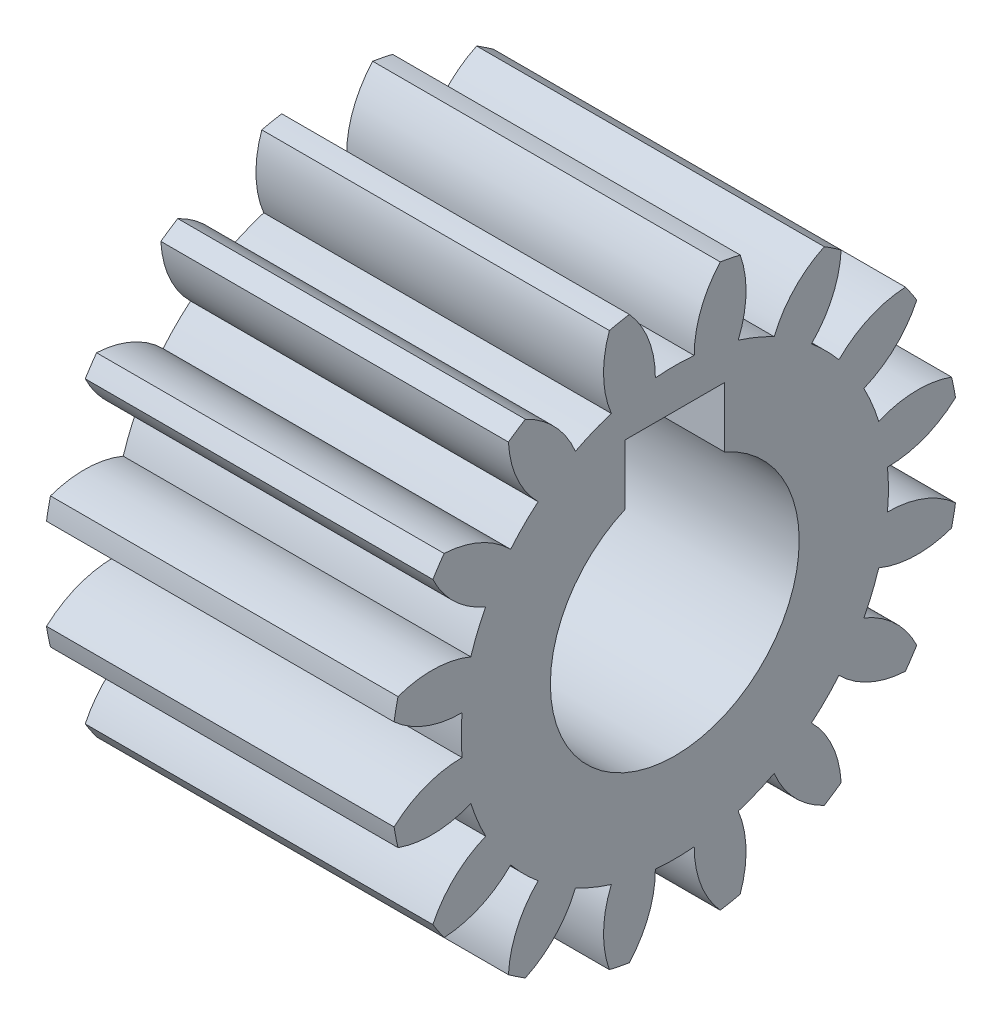
from build123d import *

# Parameters (mm, degrees)
SPUR_START             = -34.432979129
SPUR_GEAR_AI_OUTLINE_R = 4.7625
SPUR_GEAR_AI_DEPTH     = 13.97
CUT_EXTRUDE1_DEPTH     = 34.814807958


# Read off the part's stored shape, not the designer's step: spur gear_ai
with BuildPart() as part:
    # spur gear_ai outline → spur gear_ai (new body)
    with BuildSketch(Plane.YZ.offset(SPUR_START)):
        with BuildLine():
            ThreePointArc((13.280785394, 8.759491053), (13.513878524, 9.095188342), (13.734821499, 9.439004105))
            ThreePointArc((13.734821499, 9.439004105), (12.859979854, 10.643431253), (11.610114863, 11.452028906))
            ThreePointArc((11.610114863, 11.452028906), (11.941871418, 12.159942302), (12.207854471, 12.895099975))
            ThreePointArc((12.207854471, 12.895099975), (13.663407365, 12.583076847), (15.133672429, 12.816128991))
            ThreePointArc((15.133672429, 12.816128991), (15.220556611, 13.215473725), (15.293108707, 13.617669288))
            ThreePointArc((15.293108707, 13.617669288), (14.023946102, 14.395627475), (12.559784493, 14.664371671))
            ThreePointArc((12.559784493, 14.664371671), (12.595380856, 15.445356105), (12.559784493, 16.22634054))
            ThreePointArc((12.559784493, 16.22634054), (14.023946102, 16.495084736), (15.293108707, 17.273042923))
            ThreePointArc((15.293108707, 17.273042923), (15.220556611, 17.675238486), (15.133672429, 18.07458322))
            ThreePointArc((15.133672429, 18.07458322), (13.663407365, 18.307635364), (12.207854471, 17.995612236))
            ThreePointArc((12.207854471, 17.995612236), (11.941871418, 18.730769909), (11.610114863, 19.438683305))
            ThreePointArc((11.610114863, 19.438683305), (12.859979854, 20.247280957), (13.734821499, 21.451708106))
            ThreePointArc((13.734821499, 21.451708106), (13.513878524, 21.795523869), (13.280785394, 22.131221158))
            ThreePointArc((13.280785394, 22.131221158), (11.8332524, 21.783887183), (10.607902954, 20.938599424))
            ThreePointArc((10.607902954, 20.938599424), (10.080833993, 21.516009243), (9.503424174, 22.043078204))
            ThreePointArc((9.503424174, 22.043078204), (10.348711933, 23.26842765), (10.696045908, 24.715960644))
            ThreePointArc((10.696045908, 24.715960644), (10.360348619, 24.949053774), (10.016532856, 25.169996749))
            ThreePointArc((10.016532856, 25.169996749), (8.812105708, 24.295155104), (8.003508055, 23.045290113))
            ThreePointArc((8.003508055, 23.045290113), (7.295594659, 23.377046668), (6.560436986, 23.643029721))
            ThreePointArc((6.560436986, 23.643029721), (6.872460114, 25.098582615), (6.63940797, 26.568847679))
            ThreePointArc((6.63940797, 26.568847679), (6.240063236, 26.65573186), (5.837867673, 26.728283957))
            ThreePointArc((5.837867673, 26.728283957), (5.059909486, 25.459121352), (4.79116529, 23.994959743))
            ThreePointArc((4.79116529, 23.994959743), (4.010180856, 24.030556105), (3.229196421, 23.994959743))
            ThreePointArc((3.229196421, 23.994959743), (2.960452225, 25.459121352), (2.182494038, 26.728283957))
            ThreePointArc((2.182494038, 26.728283957), (1.780298475, 26.65573186), (1.380953741, 26.568847679))
            ThreePointArc((1.380953741, 26.568847679), (1.147901597, 25.098582615), (1.459924725, 23.643029721))
            ThreePointArc((1.459924725, 23.643029721), (0.724767052, 23.377046668), (0.016853656, 23.045290113))
            ThreePointArc((0.016853656, 23.045290113), (-0.791743997, 24.295155104), (-1.996171145, 25.169996749))
            ThreePointArc((-1.996171145, 25.169996749), (-2.339986908, 24.949053774), (-2.675684197, 24.715960644))
            ThreePointArc((-2.675684197, 24.715960644), (-2.328350222, 23.26842765), (-1.483062463, 22.043078204))
            ThreePointArc((-1.483062463, 22.043078204), (-2.060472282, 21.516009243), (-2.587541243, 20.938599424))
            ThreePointArc((-2.587541243, 20.938599424), (-3.812890689, 21.783887183), (-5.260423683, 22.131221158))
            ThreePointArc((-5.260423683, 22.131221158), (-5.493516813, 21.795523869), (-5.714459788, 21.451708106))
            ThreePointArc((-5.714459788, 21.451708106), (-4.839618143, 20.247280957), (-3.589753152, 19.438683305))
            ThreePointArc((-3.589753152, 19.438683305), (-3.921509707, 18.730769909), (-4.18749276, 17.995612236))
            ThreePointArc((-4.18749276, 17.995612236), (-5.643045654, 18.307635364), (-7.113310718, 18.07458322))
            ThreePointArc((-7.113310718, 18.07458322), (-7.200194899, 17.675238486), (-7.272746996, 17.273042923))
            ThreePointArc((-7.272746996, 17.273042923), (-6.003584391, 16.495084736), (-4.539422782, 16.22634054))
            ThreePointArc((-4.539422782, 16.22634054), (-4.575019144, 15.445356106), (-4.539422782, 14.664371671))
            ThreePointArc((-4.539422782, 14.664371671), (-6.003584391, 14.395627475), (-7.272746996, 13.617669288))
            ThreePointArc((-7.272746996, 13.617669288), (-7.200194899, 13.215473725), (-7.113310718, 12.816128991))
            ThreePointArc((-7.113310718, 12.816128991), (-5.643045654, 12.583076847), (-4.18749276, 12.895099975))
            ThreePointArc((-4.18749276, 12.895099975), (-3.921509707, 12.159942302), (-3.589753152, 11.452028906))
            ThreePointArc((-3.589753152, 11.452028906), (-4.839618143, 10.643431253), (-5.714459788, 9.439004105))
            ThreePointArc((-5.714459788, 9.439004105), (-5.493516813, 9.095188342), (-5.260423683, 8.759491053))
            ThreePointArc((-5.260423683, 8.759491053), (-3.812890689, 9.106825028), (-2.587541243, 9.952112787))
            ThreePointArc((-2.587541243, 9.952112787), (-2.060472282, 9.374702968), (-1.483062463, 8.847634007))
            ThreePointArc((-1.483062463, 8.847634007), (-2.328350222, 7.622284561), (-2.675684197, 6.174751567))
            ThreePointArc((-2.675684197, 6.174751567), (-2.339986908, 5.941658437), (-1.996171145, 5.720715462))
            ThreePointArc((-1.996171145, 5.720715462), (-0.791743997, 6.595557107), (0.016853656, 7.845422098))
            ThreePointArc((0.016853656, 7.845422098), (0.724767052, 7.513665543), (1.459924725, 7.24768249))
            ThreePointArc((1.459924725, 7.24768249), (1.147901597, 5.792129596), (1.380953741, 4.321864532))
            ThreePointArc((1.380953741, 4.321864532), (1.780298475, 4.23498035), (2.182494038, 4.162428254))
            ThreePointArc((2.182494038, 4.162428254), (2.960452225, 5.431590859), (3.229196421, 6.895752468))
            ThreePointArc((3.229196421, 6.895752468), (4.010180855, 6.860156105), (4.79116529, 6.895752468))
            ThreePointArc((4.79116529, 6.895752468), (5.059909486, 5.431590859), (5.837867673, 4.162428254))
            ThreePointArc((5.837867673, 4.162428254), (6.240063236, 4.23498035), (6.63940797, 4.321864532))
            ThreePointArc((6.63940797, 4.321864532), (6.872460114, 5.792129596), (6.560436986, 7.24768249))
            ThreePointArc((6.560436986, 7.24768249), (7.295594659, 7.513665543), (8.003508055, 7.845422098))
            ThreePointArc((8.003508055, 7.845422098), (8.812105708, 6.595557107), (10.016532856, 5.720715462))
            ThreePointArc((10.016532856, 5.720715462), (10.360348619, 5.941658437), (10.696045908, 6.174751567))
            ThreePointArc((10.696045908, 6.174751567), (10.348711933, 7.622284561), (9.503424174, 8.847634007))
            ThreePointArc((9.503424174, 8.847634007), (10.080833993, 9.374702968), (10.607902954, 9.952112787))
            ThreePointArc((10.607902954, 9.952112787), (11.8332524, 9.106825028), (13.280785394, 8.759491053))
        make_face()
        with Locations((4.010180856, 15.445356105)):
            Circle(SPUR_GEAR_AI_OUTLINE_R, mode=Mode.SUBTRACT)
    extrude(amount=SPUR_GEAR_AI_DEPTH)

    # Sketch1 → Cut-Extrude1 (cut, through all)
    with BuildSketch(Plane(origin=(-20.462979129, 0, 0), x_dir=(0, 0, -1), z_dir=(1, 0, 0))):
        with BuildLine():
            Line((-13.445356105, 8.59275655), (-13.445356105, 11.010180856))
            Line((-13.445356105, 11.010180856), (-17.445356105, 11.010180856))
            Line((-17.445356105, 11.010180856), (-17.445356105, 8.59275655))
            ThreePointArc((-17.445356105, 8.59275655), (-15.445356105, 9.010180856), (-13.445356105, 8.59275655))
        make_face()
        with BuildLine():
            ThreePointArc((-10.445356105, 4.010180856), (-11.262055973, 6.748793643), (-13.445356105, 8.59275655))
            Line((-13.445356105, 8.59275655), (-13.445356105, 7.010180856))
            Line((-13.445356105, 7.010180856), (-17.445356105, 7.010180856))
            Line((-17.445356105, 7.010180856), (-17.445356105, 8.59275655))
            ThreePointArc((-17.445356105, 8.59275655), (-18.183968893, -0.173119277), (-10.445356105, 4.010180856))
        make_face()
        with BuildLine():
            Line((-13.445356105, 7.010180856), (-13.445356105, 8.59275655))
            ThreePointArc((-13.445356105, 8.59275655), (-15.445356105, 9.010180856), (-17.445356105, 8.59275655))
            Line((-17.445356105, 8.59275655), (-17.445356105, 7.010180856))
            Line((-17.445356105, 7.010180856), (-13.445356105, 7.010180856))
        make_face()
    extrude(amount=-CUT_EXTRUDE1_DEPTH, mode=Mode.SUBTRACT)


solid = part.part
